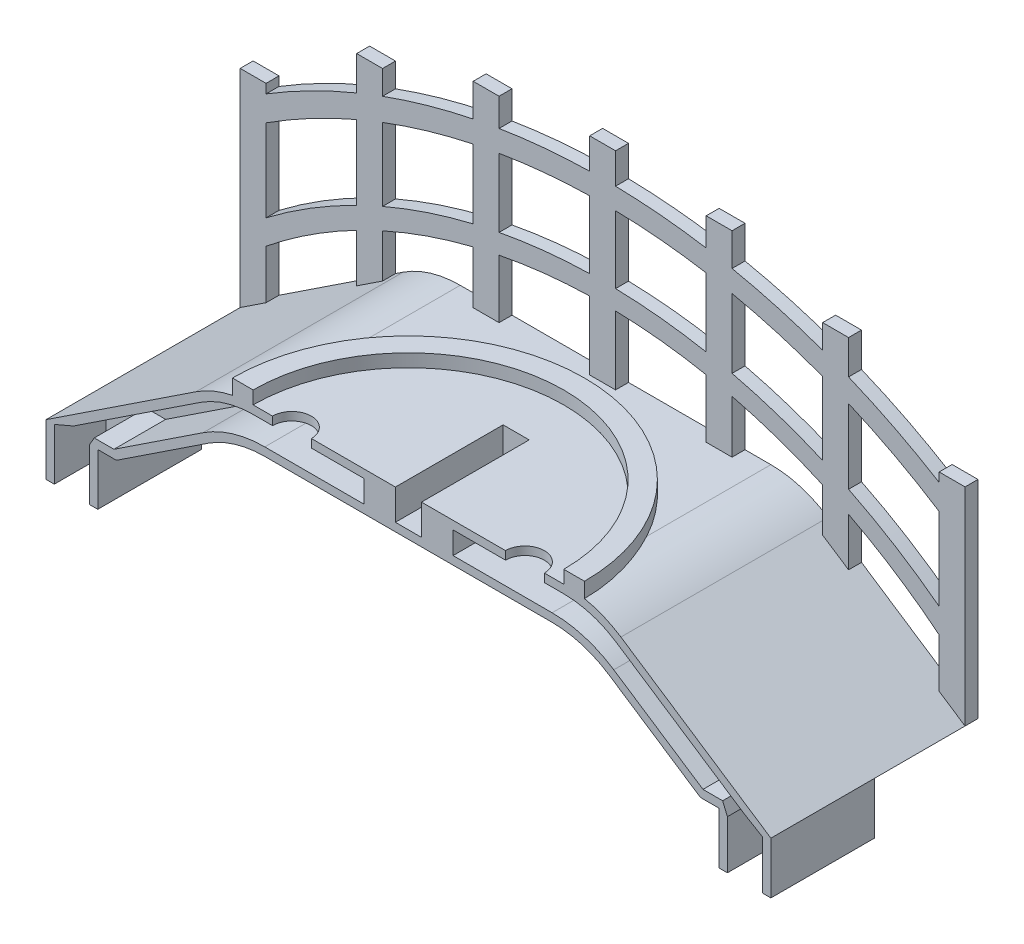
from build123d import *

# Parameters (mm, degrees)
BOSS_EXTRUDE1_DEPTH      = 12.7
BOSS_EXTRUDE2_DEPTH      = 0.79375
SKETCH5_7_W              = 1.5875
SKETCH5_7_H              = 15.875
SKETCH5_7_H_2            = 12.7
BOSS_EXTRUDE6_DEPTH      = 0.79375
BOSS_EXTRUDE7_DEPTH      = 0.79375
CUT_EXTRUDE1_DEPTH       = 9.525
SKETCH8_W                = 1.6002
SKETCH8_H                = 6.604
CUT_EXTRUDE2_DEPTH       = 1.397
BOSS_EXTRUDE8_DEPTH      = 1.397
BOSS_EXTRUDE9_DEPTH      = 0.79375
BOSS_EXTRUDE9_DEPTH_BACK = 0.254
SKETCH12_W               = 3.175
SKETCH12_H               = 6.35
BOSS_EXTRUDE10_DEPTH     = 3.175
CUT_EXTRUDE3_DEPTH       = 3.175
CUT_EXTRUDE4_DEPTH       = 3.175


with BuildPart() as part:
    # Sketch5 → Boss-Extrude1 (new body)
    with BuildSketch(Plane.XY):
        with BuildLine():
            Line((4.317823407, 0), (9.914002503, 3.699748883))
            ThreePointArc((9.914002503, 3.699748883), (11.587555655, 4.483774401), (13.415983959, 4.752709532))
            Line((13.415983959, 4.752709532), (31.034016041, 4.752709532))
            ThreePointArc((31.034016041, 4.752709532), (32.862444345, 4.483774401), (34.535997497, 3.699748883))
            Line((34.535997497, 3.699748883), (40.132176593, 0))
            Line((40.132176593, 0), (44.45, 0))
            Line((44.45, 0), (35.251981456, 6.080998883))
            ThreePointArc((35.251981456, 6.080998883), (33.578428304, 6.865024401), (31.75, 7.133959532))
            Line((31.75, 7.133959532), (12.7, 7.133959532))
            ThreePointArc((12.7, 7.133959532), (10.871571696, 6.865024401), (9.198018544, 6.080998883))
            Line((9.198018544, 6.080998883), (0, 0))
            Line((0, 0), (4.317823407, 0))
        make_face()
    extrude(amount=BOSS_EXTRUDE1_DEPTH)



with BuildPart() as body_2:
    # Sketch5<4> → Boss-Extrude2 (new body)
    with BuildSketch(Plane.XY):
        with BuildLine():
            Line((44.45, 9.525), (44.45, 11.1125))
            ThreePointArc((44.45, 11.1125), (22.225, 17.96069625), (0, 11.1125))
            Line((0, 11.1125), (0, 9.525))
            ThreePointArc((0, 9.525), (22.225, 16.658959532), (44.45, 9.525))
        make_face()
    extrude(amount=BOSS_EXTRUDE2_DEPTH)

    # Sketch5<7> → Boss-Extrude6 (add)
    with BuildSketch(Plane.XY):
        with Locations((7.9375, 9.122908395)):
            Rectangle(SKETCH5_7_W, SKETCH5_7_H)
        Polygon((0, 0), (1.5875, 1.049528839), (1.5875, 12.7), (0, 12.7), align=None)
        with Locations((15.08125, 11.222301738)):
            Rectangle(SKETCH5_7_W, SKETCH5_7_H)
        with Locations((22.225, 11.896459532)):
            Rectangle(SKETCH5_7_W, SKETCH5_7_H)
        with BuildLine():
            Line((28.575, 3.284801738), (30.1625, 3.284801738))
            Line((30.1625, 3.284801738), (30.1625, 15.824904204))
            ThreePointArc((30.1625, 15.824904204), (29.370349797, 15.984497043), (28.575, 16.127292418))
            Line((28.575, 16.127292418), (28.575, 3.284801738))
        make_face()
        with BuildLine():
            Line((28.575, 19.159801738), (28.575, 17.446790716))
            ThreePointArc((28.575, 17.446790716), (29.370242514, 17.308866955), (30.1625, 17.154718663))
            Line((30.1625, 17.154718663), (30.1625, 19.159801738))
            Line((30.1625, 19.159801738), (28.575, 19.159801738))
        make_face()
        with Locations((36.5125, 9.122908395)):
            Rectangle(SKETCH5_7_W, SKETCH5_7_H)
        with Locations((43.65625, 6.35)):
            Rectangle(SKETCH5_7_W, SKETCH5_7_H_2)
    extrude(amount=BOSS_EXTRUDE6_DEPTH)


with BuildPart() as part_1:
    add(part.part)

    add(body_2.part)  # Boss-Extrude7 merges body 2
    # Sketch6 → Boss-Extrude7 (add)
    with BuildSketch(Plane(origin=(0, 0, 0), x_dir=(-1, 0, 0), z_dir=(0, 0, -1))):
        with BuildLine():
            Line((-44.45, 4.270423014), (-44.45, 2.682923014))
            ThreePointArc((-44.45, 2.682923014), (-22.225, 11.337252313), (0, 2.682923014))
            Line((0, 2.682923014), (0, 4.270423014))
            ThreePointArc((0, 4.270423014), (-22.225, 12.523643082), (-44.45, 4.270423014))
        make_face()
    extrude(amount=-BOSS_EXTRUDE7_DEPTH)

    # Sketch7 → Cut-Extrude1 (cut)
    with BuildSketch(Plane.XY.offset(12.7)):
        Polygon((31.75, 6.625959532), (12.7, 6.625959532), (12.7, 5.260709532), (13.415983959, 5.260709532), (31.034016041, 5.260709532), (31.75, 5.260709532), align=None)
    extrude(amount=-CUT_EXTRUDE1_DEPTH, mode=Mode.SUBTRACT)

    # Sketch8 → Cut-Extrude2 (cut)
    with BuildSketch(Plane(origin=(0, 7.133959532, 0), x_dir=(1, 0, 0), z_dir=(0, 1, 0))):
        with BuildLine():
            Line((13.890625, -12.7), (16.271875, -12.7))
            ThreePointArc((16.271875, -12.7), (15.08125, -11.509375), (13.890625, -12.7))
        make_face()
        with BuildLine():
            ThreePointArc((30.559375, -12.7), (29.36875, -11.509375), (28.178125, -12.7))
            Line((28.178125, -12.7), (30.559375, -12.7))
        make_face()
        with Locations((22.225, -9.398)):
            Rectangle(SKETCH8_W, SKETCH8_H)
    extrude(amount=-CUT_EXTRUDE2_DEPTH, mode=Mode.SUBTRACT)

    # Sketch10 → Boss-Extrude8 (add)
    with BuildSketch(Plane(origin=(0, 5.260709532, 0), x_dir=(1, 0, 0), z_dir=(0, 1, 0))):
        Polygon((19.488784942, -5.496745829), (19.488784942, -12.7), (21.4249, -12.7), (21.4249, -6.096), (23.0251, -6.096), (23.0251, -12.7), (24.961215058, -12.7), (24.961215058, -5.496745829), align=None)
    extrude(amount=BOSS_EXTRUDE8_DEPTH)

    # Sketch11 → Boss-Extrude9 (add, two sides: drawn at the far end of the back side and taken through both)
    with BuildSketch(Plane(origin=(0, 7.133959532, 0), x_dir=(1, 0, 0), z_dir=(0, 1, 0)).offset(-BOSS_EXTRUDE9_DEPTH_BACK)):
        with BuildLine():
            Line((11.43, -12.7), (12.7, -12.7))
            ThreePointArc((12.7, -12.7), (22.225, -3.175), (31.75, -12.7))
            Line((31.75, -12.7), (33.02, -12.7))
            ThreePointArc((33.02, -12.7), (22.225, -1.905), (11.43, -12.7))
        make_face()
    extrude(amount=BOSS_EXTRUDE9_DEPTH + BOSS_EXTRUDE9_DEPTH_BACK)

    # Sketch12 → Boss-Extrude10 (add)
    with BuildSketch(Plane.XZ):
        with Locations((1.5875, 9.525)):
            Rectangle(SKETCH12_W, SKETCH12_H)
        with Locations((42.8625, 9.525)):
            Rectangle(SKETCH12_W, SKETCH12_H)
    extrude(amount=BOSS_EXTRUDE10_DEPTH)

    # Sketch7<4> → Cut-Extrude3 (cut)
    with BuildSketch(Plane.XY.offset(12.7)):
        with BuildLine():
            Line((12.7, 5.260709532), (12.7, 6.625959532))
            ThreePointArc((12.7, 6.625959532), (11.017845961, 6.378539211), (9.478177061, 5.657235735))
            Line((9.478177061, 5.657235735), (1.689528076, 0.508))
            Line((1.689528076, 0.508), (4.165080162, 0.508))
            Line((4.165080162, 0.508), (9.633843986, 4.123512031))
            ThreePointArc((9.633843986, 4.123512031), (11.441281391, 4.97025959), (13.415983959, 5.260709532))
            Line((13.415983959, 5.260709532), (12.7, 5.260709532))
        make_face()
        with BuildLine():
            ThreePointArc((34.971822939, 5.657235735), (33.432154039, 6.378539211), (31.75, 6.625959532))
            Line((31.75, 6.625959532), (31.75, 5.260709532))
            Line((31.75, 5.260709532), (31.034016041, 5.260709532))
            ThreePointArc((31.034016041, 5.260709532), (33.008718609, 4.97025959), (34.816156014, 4.123512031))
            Line((34.816156014, 4.123512031), (40.284919838, 0.508))
            Line((40.284919838, 0.508), (42.760471924, 0.508))
            Line((42.760471924, 0.508), (34.971822939, 5.657235735))
        make_face()
    extrude(amount=-CUT_EXTRUDE3_DEPTH, mode=Mode.SUBTRACT)

    # Sketch15 → Cut-Extrude4 (cut)
    with BuildSketch(Plane.XY.offset(12.7)):
        Polygon((1.689528076, 0.508), (0.508, 0), (0.508, -3.175), (2.667, -3.175), (2.667, 0), (2.959528076, 0.508), align=None)
        Polygon((42.760471924, 0.508), (43.942, -0.194342167), (43.942, -3.175), (41.783, -3.175), (41.783, -0.194342167), (41.490471924, 0.508), align=None)
    extrude(amount=-CUT_EXTRUDE4_DEPTH, mode=Mode.SUBTRACT)


solid = part_1.part
